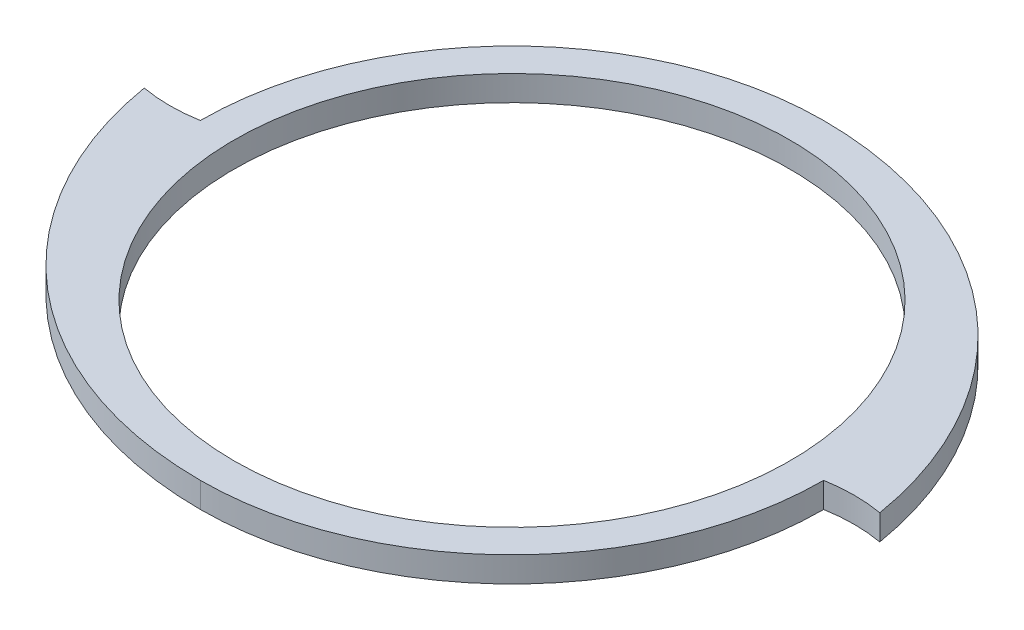
from build123d import *

# Parameters (mm, degrees)
SKETCH1_R           = 99
BOSS_EXTRUDE1_DEPTH = 4.5
CIRPATTERN1_COUNT   = 2


with BuildPart() as part:
    # Sketch1 → Boss-Extrude1 (new, symmetric)
    with BuildSketch(Plane(origin=(0, 0, 0), x_dir=(1, 0, 0), z_dir=(0, 1, 0))):
        with BuildLine():
            ThreePointArc((0, -111), (78.488852712, 78.488852712), (-111, 0))
            ThreePointArc((-111, 0), (-121, -0.874886635), (-131, 0))
            ThreePointArc((-131, 0), (-85.851616176, -79.518574045), (0, -111))
        make_face()
        Circle(SKETCH1_R, mode=Mode.SUBTRACT)
    boss_extrude1 = extrude(amount=BOSS_EXTRUDE1_DEPTH, both=True)

    # CirPattern1: Boss-Extrude1 ×2 about axis
    cirpattern1_axis = Axis((0, 4.5, 0), (0, -1, 0))
    for i in range(1, CIRPATTERN1_COUNT):
        add(boss_extrude1.rotate(cirpattern1_axis, i * 360 / CIRPATTERN1_COUNT))


solid = part.part
